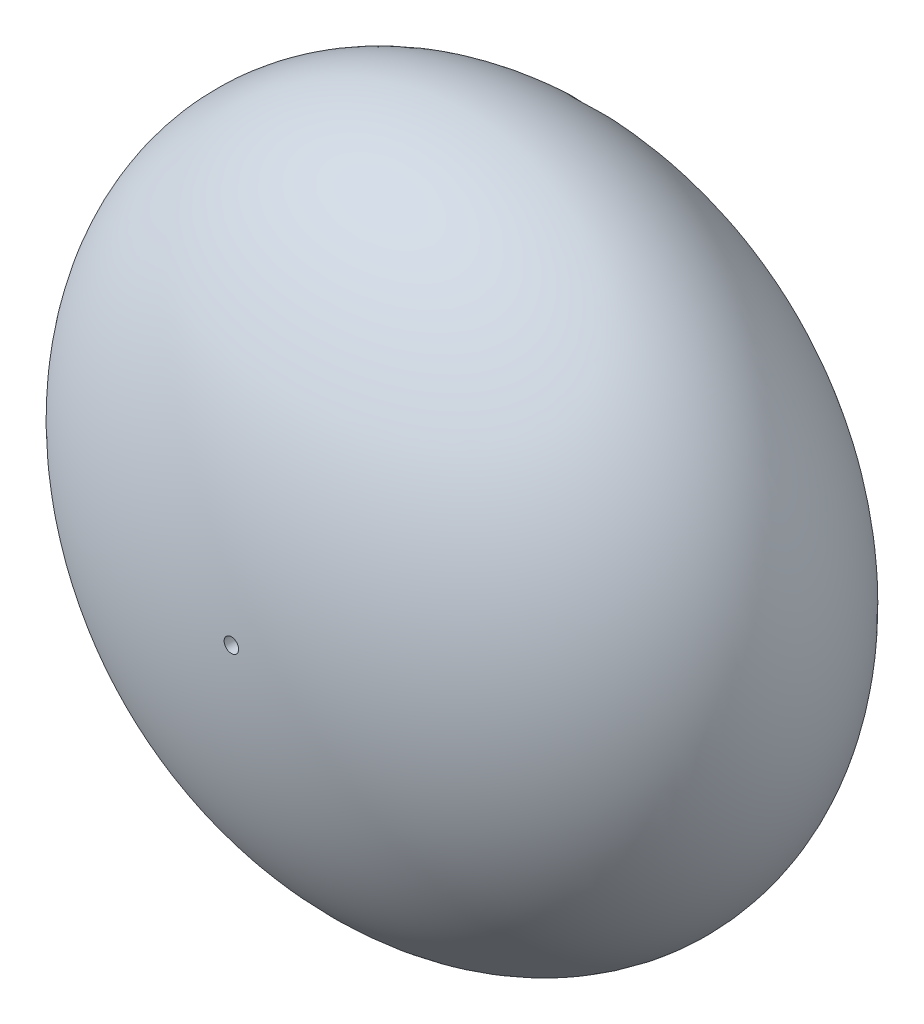
from build123d import *

# Parameters (mm, degrees)
SKETCH3_R               = 7
CUT_EXTRUDE1_DEPTH      = 13
CUT_EXTRUDE2_DEPTH      = 42.041138069
CUT_EXTRUDE2_DEPTH_BACK = 42.041138069
SKETCH4_R               = 0.55
CUT_EXTRUDE3_DEPTH      = 42.039500113
CUT_EXTRUDE3_DEPTH_BACK = 42.039500113
SKETCH5_R               = 1.4


with BuildPart() as part:
    # Sketch1 → Revolve4 (revolve)
    with BuildSketch(Plane(origin=(0, 0, 0), x_dir=(1, 0, 0), z_dir=(0, 1, 0))):
        with BuildLine():
            Line((0, 17.5), (0, -17.5))
            add(Edge.make_bspline(
                [(0, -17.5), (26.25, -17.5), (26.25, 0), (26.25, 17.5), (0, 17.5)],
                knots=[1.570796327, 1.570796327, 1.570796327, 3.141592654, 3.141592654, 4.71238898, 4.71238898, 4.71238898], degree=2, weights=[1, 0.707106781, 1, 0.707106781, 1]))
        make_face()
    revolve(axis=Axis((0, 0, -17.5), (0, 0, 1)))

    # Sketch3 → Cut-Extrude1 (cut)
    with BuildSketch(Plane.XY):
        Circle(SKETCH3_R)
    extrude(amount=CUT_EXTRUDE1_DEPTH, mode=Mode.SUBTRACT)

    # Sketch4 → Cut-Extrude2 (cut, two sides: drawn at the far end of the back side and taken through both)
    with BuildSketch(Plane.XY.offset(-CUT_EXTRUDE2_DEPTH_BACK)):
        Circle(SKETCH4_R)
    extrude(amount=CUT_EXTRUDE2_DEPTH + CUT_EXTRUDE2_DEPTH_BACK, mode=Mode.SUBTRACT)

    # Sketch5 → Cut-Extrude3 (cut, two sides: drawn at the far end of the back side and taken through both)
    with BuildSketch(Plane(origin=(0, 0, 0), x_dir=(1, 0, 0), z_dir=(0, 1, 0)).offset(-CUT_EXTRUDE3_DEPTH_BACK)):
        with Locations((0, 10)):
            Circle(SKETCH5_R)
    extrude(amount=CUT_EXTRUDE3_DEPTH + CUT_EXTRUDE3_DEPTH_BACK, mode=Mode.SUBTRACT)


solid = part.part
